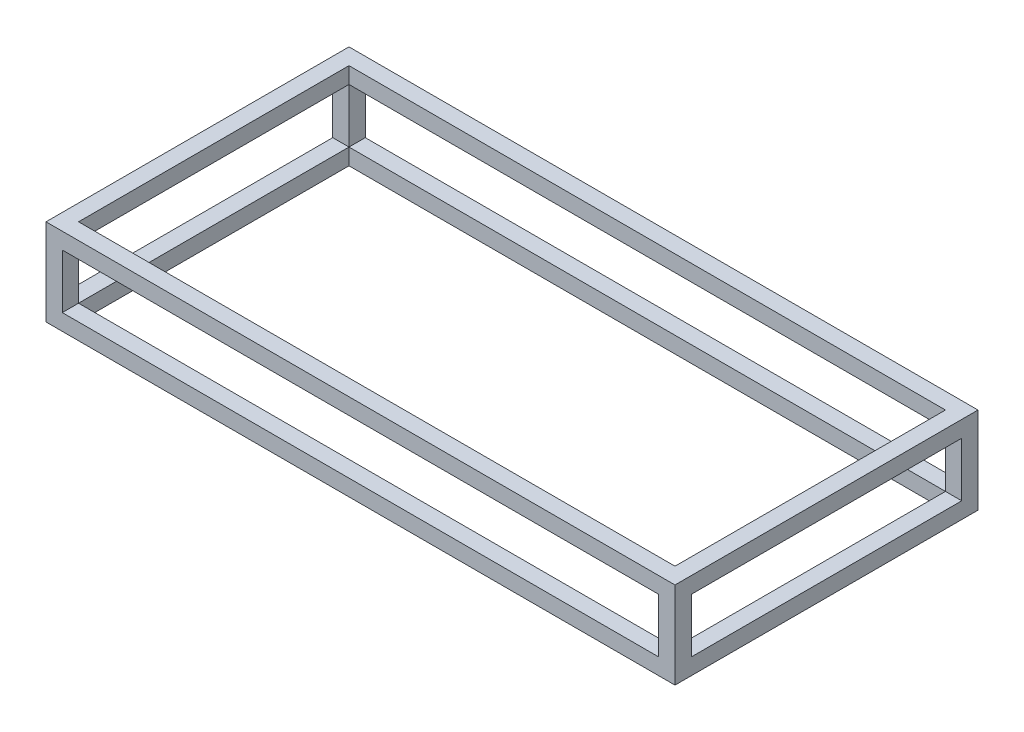
from build123d import *

# Parameters (mm, degrees)
SKETCH3_W           = 580
SKETCH3_H           = 279.4
SKETCH3_W_2         = 550
SKETCH3_H_2         = 249.4
BOSS_EXTRUDE3_DEPTH = 15
SKETCH4_W           = 15
SKETCH4_H           = 15
BOSS_EXTRUDE4_DEPTH = 50
SKETCH5_W           = 580
SKETCH5_H           = 279.4
SKETCH5_W_2         = 550
SKETCH5_H_2         = 249.4
BOSS_EXTRUDE6_DEPTH = 15


with BuildPart() as part:
    # Sketch3 → Boss-Extrude3 (new body)
    with BuildSketch(Plane(origin=(0, 0, 0), x_dir=(1, 0, 0), z_dir=(0, 1, 0))):
        Rectangle(SKETCH3_W, SKETCH3_H)
        Rectangle(SKETCH3_W_2, SKETCH3_H_2, mode=Mode.SUBTRACT)
    extrude(amount=BOSS_EXTRUDE3_DEPTH)

    # Sketch4 → Boss-Extrude4 (add)
    with BuildSketch(Plane(origin=(0, 15, 0), x_dir=(1, 0, 0), z_dir=(0, 1, 0))):
        with Locations((-282.5, 132.2)):
            Rectangle(SKETCH4_W, SKETCH4_H)
        with Locations((-282.5, -132.2)):
            Rectangle(SKETCH4_W, SKETCH4_H)
        with Locations((282.5, -132.2)):
            Rectangle(SKETCH4_W, SKETCH4_H)
        with Locations((282.5, 132.2)):
            Rectangle(SKETCH4_W, SKETCH4_H)
    extrude(amount=BOSS_EXTRUDE4_DEPTH)

    # Sketch5 → Boss-Extrude6 (add)
    with BuildSketch(Plane(origin=(0, 65, 0), x_dir=(1, 0, 0), z_dir=(0, 1, 0))):
        Rectangle(SKETCH5_W, SKETCH5_H)
        Rectangle(SKETCH5_W_2, SKETCH5_H_2, mode=Mode.SUBTRACT)
    extrude(amount=BOSS_EXTRUDE6_DEPTH)


solid = part.part
